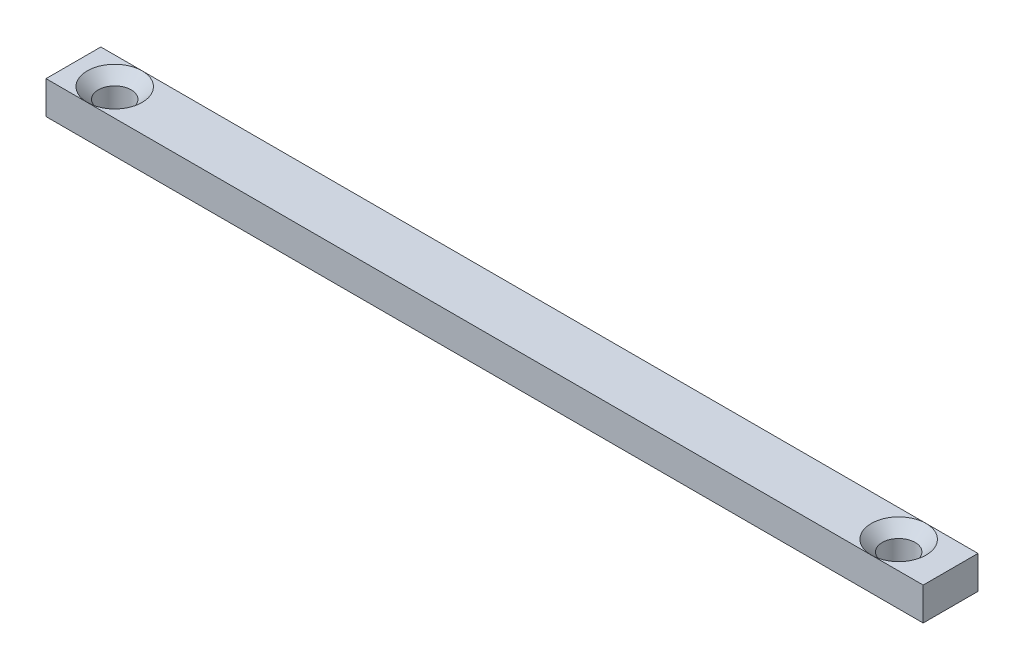
from build123d import *

# Parameters (mm, degrees)
SKETCH1_W           = 80
SKETCH1_H           = 5
SKETCH1_R           = 1.5
BOSS_EXTRUDE1_DEPTH = 3
CHAMFER1_SIZE       = 1


with BuildPart() as part:
    # Sketch1 → Boss-Extrude1 (new body)
    with BuildSketch(Plane(origin=(0, 0, 0), x_dir=(1, 0, 0), z_dir=(0, 1, 0))):
        with Locations((8.025662252, 4.919288079)):
            Rectangle(SKETCH1_W, SKETCH1_H)
        with Locations(Location((-28.208163206, 4.919288079, 0), (0, 0, 270))):
            Circle(SKETCH1_R, mode=Mode.SUBTRACT)
        with Locations(Location((43.291836794, 4.919288079, 0), (0, 0, 270))):
            Circle(SKETCH1_R, mode=Mode.SUBTRACT)
    extrude(amount=BOSS_EXTRUDE1_DEPTH)

    # Chamfer1
    chamfer1_edges = [part.edges().sort_by_distance(p)[0] for p in [
        (-28.208163206, 3, -6.419288079),
        (43.291836794, 3, -6.419288079),
    ]]
    chamfer(chamfer1_edges, length=CHAMFER1_SIZE - 0.0001)  # a hair under: the kernel refuses the full size


solid = part.part
